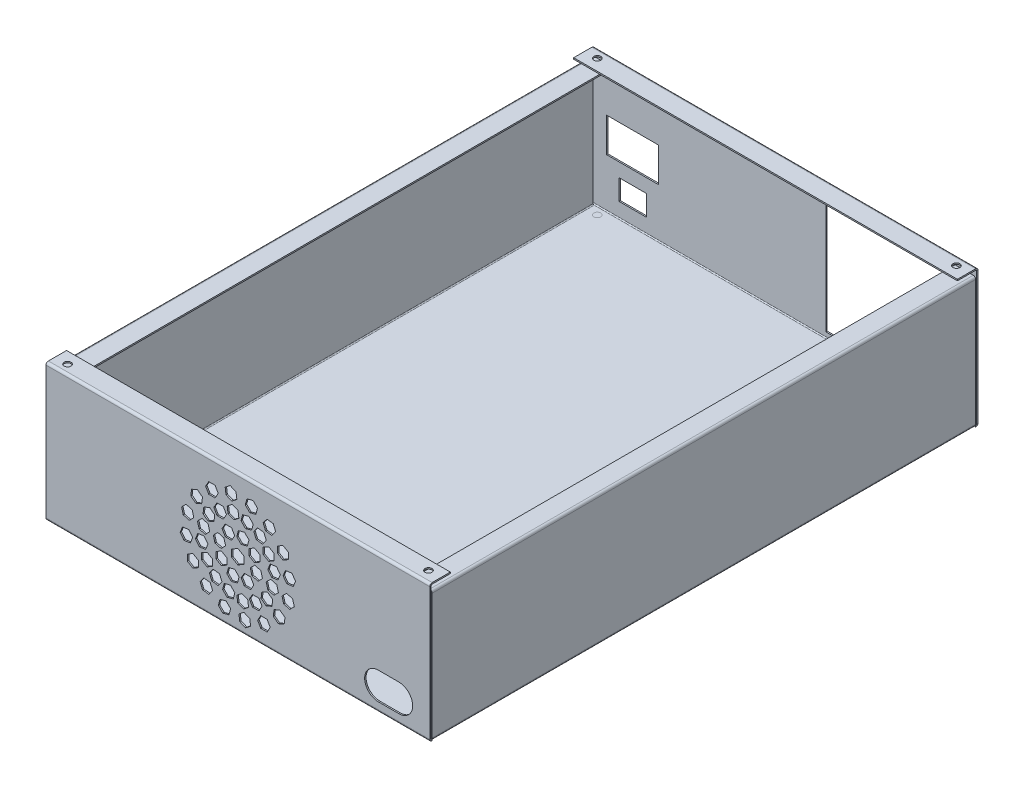
from build123d import *

# Parameters (mm, degrees)
SKETCH2_W                           = 280
SKETCH2_H                           = 400
BASE_FLANGE1_DEPTH                  = 1
FRONT_BACK_PLANES_STRIP_W           = 5.4732
FRONT_BACK_PLANES_STRIP_H           = 1
FRONT_BACK_PLANES_STRIP_CUT_DEPTH   = 280
FRONT_BACK_PLANES_STRIP_2_W         = 5.4732
FRONT_BACK_PLANES_STRIP_2_H         = 1
FRONT_BACK_PLANES_STRIP_CUT_2_DEPTH = 280
FRONT_BACK_PLANES_DEPTH             = 280
FRONT_BACK_PLANES_BEND_DEPTH        = 280
TOP_SLIDERS_STRIP_W                 = 5.4732
TOP_SLIDERS_STRIP_H                 = 1
TOP_SLIDERS_STRIP_CUT_DEPTH         = 280
TOP_SLIDERS_STRIP_2_W               = 5.4732
TOP_SLIDERS_STRIP_2_H               = 1
TOP_SLIDERS_STRIP_CUT_2_DEPTH       = 280
TOP_SLIDERS_DEPTH                   = 280
TOP_SLIDERS_BEND_DEPTH              = 280
LEFT_RIGHT_PLANES_STRIP_W           = 5.4732
LEFT_RIGHT_PLANES_STRIP_H           = 1
LEFT_RIGHT_PLANES_STRIP_CUT_DEPTH   = 396.5268
LEFT_RIGHT_PLANES_STRIP_2_W         = 5.4732
LEFT_RIGHT_PLANES_STRIP_2_H         = 1
LEFT_RIGHT_PLANES_STRIP_CUT_2_DEPTH = 396.5268
LEFT_RIGHT_PLANES_DEPTH             = 396.5268
LEFT_RIGHT_PLANES_BEND_DEPTH        = 396.5268
BOTTOM_SLIDERS_STRIP_W              = 5.4732
BOTTOM_SLIDERS_STRIP_H              = 1
BOTTOM_SLIDERS_STRIP_CUT_DEPTH      = 396.5268
BOTTOM_SLIDERS_STRIP_2_W            = 5.4732
BOTTOM_SLIDERS_STRIP_2_H            = 1
BOTTOM_SLIDERS_STRIP_CUT_2_DEPTH    = 396.5268
BOTTOM_SLIDERS_DEPTH                = 396.5268
BOTTOM_SLIDERS_BEND_DEPTH           = 396.5268
SKETCH51_R                          = 2.5
SCREW_HOLES_BACK_DEPTH              = 99
SKETCH52_R                          = 2.5
SCREW_HOLES_FRONT_DEPTH             = 99
SKETCH57_W                          = 88
SKETCH57_H                          = 88
OUTPUT_DEPTH                        = 1
SKETCH63_W                          = 38
SKETCH63_H                          = 25
SKETCH63_W_2                        = 20
SKETCH63_H_2                        = 15
DISPLAY_AND_BUTTON_DEPTH            = 20
INPUT_SOCKET_DEPTH                  = 20
FAN_OUTLET_DEPTH                    = 10


# Sheet-metal steps are written as plain solids
with BuildPart() as part:
    # Sketch2 → Base-Flange1 (new body)
    with BuildSketch(Plane(origin=(0, 0, 0), x_dir=(1, 0, 0), z_dir=(0, 1, 0))):
        Rectangle(SKETCH2_W, SKETCH2_H)
    extrude(amount=BASE_FLANGE1_DEPTH)

    # Front_back_planes strip (across the edge) → Front_back_planes strip cut (cut)
    with BuildSketch(Plane(origin=(140, 1, -200), x_dir=(0, 0, 1), z_dir=(-1, 0, 0))):
        with Locations((-1, -0.5)):
            Rectangle(FRONT_BACK_PLANES_STRIP_W, FRONT_BACK_PLANES_STRIP_H)
    extrude(amount=FRONT_BACK_PLANES_STRIP_CUT_DEPTH, mode=Mode.SUBTRACT)

    # Front_back_planes strip 2 (across the edge) → Front_back_planes strip cut 2 (cut)
    with BuildSketch(Plane(origin=(-140, 1, 200), x_dir=(0, 0, -1), z_dir=(1, 0, 0))):
        with Locations((-1, -0.5)):
            Rectangle(FRONT_BACK_PLANES_STRIP_2_W, FRONT_BACK_PLANES_STRIP_2_H)
    extrude(amount=FRONT_BACK_PLANES_STRIP_CUT_2_DEPTH, mode=Mode.SUBTRACT)

    # Front_back_planes section (across the edge) → Front_back_planes (add)
    with BuildSketch(Plane(origin=(140, 1, -200), x_dir=(0, 0, 1), z_dir=(-1, 0, 0))):
        with BuildLine():
            Line((0, 0.7366), (0, 99))
            Line((0, 99), (1, 99))
            Line((1, 99), (1, 0.7366))
            ThreePointArc((1, 0.7366), (1.215745145, 0.215745145), (1.7366, 0))
            Line((1.7366, 0), (1.7366, -1))
            ThreePointArc((1.7366, -1), (0.508638364, -0.491361636), (0, 0.7366))
        make_face()
    extrude(amount=FRONT_BACK_PLANES_DEPTH)

    # Front_back_planes section 2 (across the edge) → Front_back_planes bend (add)
    with BuildSketch(Plane(origin=(-140, 1, 200), x_dir=(0, 0, -1), z_dir=(1, 0, 0))):
        with BuildLine():
            Line((0, 0.7366), (0, 99))
            Line((0, 99), (1, 99))
            Line((1, 99), (1, 0.7366))
            ThreePointArc((1, 0.7366), (1.215745145, 0.215745145), (1.7366, 0))
            Line((1.7366, 0), (1.7366, -1))
            ThreePointArc((1.7366, -1), (0.508638364, -0.491361636), (0, 0.7366))
        make_face()
    extrude(amount=FRONT_BACK_PLANES_BEND_DEPTH)

    # Top_sliders strip (across the edge) → Top_sliders strip cut (cut)
    with BuildSketch(Plane(origin=(-140, 100, 199), x_dir=(0, -1, 0), z_dir=(1, 0, 0))):
        with Locations((-1, -0.5)):
            Rectangle(TOP_SLIDERS_STRIP_W, TOP_SLIDERS_STRIP_H)
    extrude(amount=TOP_SLIDERS_STRIP_CUT_DEPTH, mode=Mode.SUBTRACT)

    # Top_sliders strip 2 (across the edge) → Top_sliders strip cut 2 (cut)
    with BuildSketch(Plane(origin=(140, 100, -199), x_dir=(0, -1, 0), z_dir=(-1, 0, 0))):
        with Locations((-1, -0.5)):
            Rectangle(TOP_SLIDERS_STRIP_2_W, TOP_SLIDERS_STRIP_2_H)
    extrude(amount=TOP_SLIDERS_STRIP_CUT_2_DEPTH, mode=Mode.SUBTRACT)

    # Top_sliders section (across the edge) → Top_sliders (add)
    with BuildSketch(Plane(origin=(-140, 100, 199), x_dir=(0, -1, 0), z_dir=(1, 0, 0))):
        with BuildLine():
            Line((0, 0.7366), (0, 14))
            Line((0, 14), (1, 14))
            Line((1, 14), (1, 0.7366))
            ThreePointArc((1, 0.7366), (1.215745145, 0.215745145), (1.7366, 0))
            Line((1.7366, 0), (1.7366, -1))
            ThreePointArc((1.7366, -1), (0.508638364, -0.491361636), (0, 0.7366))
        make_face()
    extrude(amount=TOP_SLIDERS_DEPTH)

    # Top_sliders section 2 (across the edge) → Top_sliders bend (add)
    with BuildSketch(Plane(origin=(140, 100, -199), x_dir=(0, -1, 0), z_dir=(-1, 0, 0))):
        with BuildLine():
            Line((0, 0.7366), (0, 14))
            Line((0, 14), (1, 14))
            Line((1, 14), (1, 0.7366))
            ThreePointArc((1, 0.7366), (1.215745145, 0.215745145), (1.7366, 0))
            Line((1.7366, 0), (1.7366, -1))
            ThreePointArc((1.7366, -1), (0.508638364, -0.491361636), (0, 0.7366))
        make_face()
    extrude(amount=TOP_SLIDERS_BEND_DEPTH)

    # Left_right_planes strip (across the edge) → Left_right_planes strip cut (cut)
    with BuildSketch(Plane(origin=(-140, 1, -198.2634), x_dir=(1, 0, 0), z_dir=(0, 0, 1))):
        with Locations((-1, -0.5)):
            Rectangle(LEFT_RIGHT_PLANES_STRIP_W, LEFT_RIGHT_PLANES_STRIP_H)
    extrude(amount=LEFT_RIGHT_PLANES_STRIP_CUT_DEPTH, mode=Mode.SUBTRACT)

    # Left_right_planes strip 2 (across the edge) → Left_right_planes strip cut 2 (cut)
    with BuildSketch(Plane(origin=(140, 1, 198.2634), x_dir=(-1, 0, 0), z_dir=(0, 0, -1))):
        with Locations((-1, -0.5)):
            Rectangle(LEFT_RIGHT_PLANES_STRIP_2_W, LEFT_RIGHT_PLANES_STRIP_2_H)
    extrude(amount=LEFT_RIGHT_PLANES_STRIP_CUT_2_DEPTH, mode=Mode.SUBTRACT)

    # Left_right_planes section (across the edge) → Left_right_planes (add)
    with BuildSketch(Plane(origin=(-140, 1, -198.2634), x_dir=(1, 0, 0), z_dir=(0, 0, 1))):
        with BuildLine():
            Line((0, 0.7366), (0, 94))
            Line((0, 94), (1, 94))
            Line((1, 94), (1, 0.7366))
            ThreePointArc((1, 0.7366), (1.215745145, 0.215745145), (1.7366, 0))
            Line((1.7366, 0), (1.7366, -1))
            ThreePointArc((1.7366, -1), (0.508638364, -0.491361636), (0, 0.7366))
        make_face()
    extrude(amount=LEFT_RIGHT_PLANES_DEPTH)

    # Left_right_planes section 2 (across the edge) → Left_right_planes bend (add)
    with BuildSketch(Plane(origin=(140, 1, 198.2634), x_dir=(-1, 0, 0), z_dir=(0, 0, -1))):
        with BuildLine():
            Line((0, 0.7366), (0, 94))
            Line((0, 94), (1, 94))
            Line((1, 94), (1, 0.7366))
            ThreePointArc((1, 0.7366), (1.215745145, 0.215745145), (1.7366, 0))
            Line((1.7366, 0), (1.7366, -1))
            ThreePointArc((1.7366, -1), (0.508638364, -0.491361636), (0, 0.7366))
        make_face()
    extrude(amount=LEFT_RIGHT_PLANES_BEND_DEPTH)

    # Bottom_sliders strip (across the edge) → Bottom_sliders strip cut (cut)
    with BuildSketch(Plane(origin=(-139, 95, -198.2634), x_dir=(0, -1, 0), z_dir=(0, 0, 1))):
        with Locations((-1, -0.5)):
            Rectangle(BOTTOM_SLIDERS_STRIP_W, BOTTOM_SLIDERS_STRIP_H)
    extrude(amount=BOTTOM_SLIDERS_STRIP_CUT_DEPTH, mode=Mode.SUBTRACT)

    # Bottom_sliders strip 2 (across the edge) → Bottom_sliders strip cut 2 (cut)
    with BuildSketch(Plane(origin=(139, 95, 198.2634), x_dir=(0, -1, 0), z_dir=(0, 0, -1))):
        with Locations((-1, -0.5)):
            Rectangle(BOTTOM_SLIDERS_STRIP_2_W, BOTTOM_SLIDERS_STRIP_2_H)
    extrude(amount=BOTTOM_SLIDERS_STRIP_CUT_2_DEPTH, mode=Mode.SUBTRACT)

    # Bottom_sliders section (across the edge) → Bottom_sliders (add)
    with BuildSketch(Plane(origin=(-139, 95, -198.2634), x_dir=(0, -1, 0), z_dir=(0, 0, 1))):
        with BuildLine():
            Line((0, 0.7366), (0, 14))
            Line((0, 14), (1, 14))
            Line((1, 14), (1, 0.7366))
            ThreePointArc((1, 0.7366), (1.215745145, 0.215745145), (1.7366, 0))
            Line((1.7366, 0), (1.7366, -1))
            ThreePointArc((1.7366, -1), (0.508638364, -0.491361636), (0, 0.7366))
        make_face()
    extrude(amount=BOTTOM_SLIDERS_DEPTH)

    # Bottom_sliders section 2 (across the edge) → Bottom_sliders bend (add)
    with BuildSketch(Plane(origin=(139, 95, 198.2634), x_dir=(0, -1, 0), z_dir=(0, 0, -1))):
        with BuildLine():
            Line((0, 0.7366), (0, 14))
            Line((0, 14), (1, 14))
            Line((1, 14), (1, 0.7366))
            ThreePointArc((1, 0.7366), (1.215745145, 0.215745145), (1.7366, 0))
            Line((1.7366, 0), (1.7366, -1))
            ThreePointArc((1.7366, -1), (0.508638364, -0.491361636), (0, 0.7366))
        make_face()
    extrude(amount=BOTTOM_SLIDERS_BEND_DEPTH)

    # Sketch51 → Screw_Holes_back (cut)
    with BuildSketch(Plane(origin=(0, 100, 0), x_dir=(1, 0, 0), z_dir=(0, 1, 0))):
        with Locations((131, -191.940102497)):
            Circle(SKETCH51_R)
        with Locations((-131, -193.2634)):
            Circle(SKETCH51_R)
    extrude(amount=-SCREW_HOLES_BACK_DEPTH, mode=Mode.SUBTRACT)

    # Sketch52 → Screw_Holes_front (cut)
    with BuildSketch(Plane(origin=(0, 100, 0), x_dir=(1, 0, 0), z_dir=(0, 1, 0))):
        with Locations((131, 193.2634)):
            Circle(SKETCH52_R)
        with Locations((-131, 193.2634)):
            Circle(SKETCH52_R)
    extrude(amount=-SCREW_HOLES_FRONT_DEPTH, mode=Mode.SUBTRACT)

    # Sketch57 → Output (cut)
    with BuildSketch(Plane(origin=(0, 0, -200), x_dir=(-1, 0, 0), z_dir=(0, 0, -1))):
        with Locations((-74, 48.7366)):
            Rectangle(SKETCH57_W, SKETCH57_H)
    extrude(amount=-OUTPUT_DEPTH, mode=Mode.SUBTRACT)

    # Sketch63 → Display_and_button (cut)
    with BuildSketch(Plane(origin=(0, 0, -200), x_dir=(-1, 0, 0), z_dir=(0, 0, -1))):
        with Locations((111, 49.2366)):
            Rectangle(SKETCH63_W, SKETCH63_H)
        with Locations((111, 19.2366)):
            Rectangle(SKETCH63_W_2, SKETCH63_H_2)
    extrude(amount=-DISPLAY_AND_BUTTON_DEPTH, mode=Mode.SUBTRACT)

    # Sketch66 → Input_Socket (cut)
    with BuildSketch(Plane.XY.offset(200)):
        with BuildLine():
            Line((117.5, 6.7366), (102.5, 6.7366))
            ThreePointArc((102.5, 6.7366), (92.5, 16.7366), (102.5, 26.7366))
            Line((102.5, 26.7366), (117.5, 26.7366))
            ThreePointArc((117.5, 26.7366), (127.5, 16.7366), (117.5, 6.7366))
        make_face()
    extrude(amount=-INPUT_SOCKET_DEPTH, mode=Mode.SUBTRACT)

    # Sketch69 → Fan_outlet (cut)
    with BuildSketch(Plane.XY.offset(200)):
        Polygon((-8.32179677, 69.60492027), (-10.631197846, 73.60492027), (-15.25, 73.60492027), (-17.559401077, 69.60492027), (-15.25, 65.60492027), (-10.631197846, 65.60492027), align=None)
        Polygon((-21.25, 83.997225115), (-23.559401077, 79.997225115), (-21.25, 75.997225115), (-16.631197846, 75.997225115), (-14.32179677, 79.997225115), (-16.631197846, 83.997225115), align=None)
        Polygon((-2.32179677, 59.212615425), (-4.631197846, 63.212615425), (-9.25, 63.212615425), (-11.559401077, 59.212615425), (-9.25, 55.212615425), (-4.631197846, 55.212615425), align=None)
        Polygon((5.38962643, 82.595246841), (8.655612754, 79.329260517), (13.117033041, 80.52469448), (14.312467004, 84.986114766), (11.04648068, 88.25210109), (6.585060393, 87.056667127), align=None)
        Polygon((11.206638462, 73.395004851), (7.940652139, 76.660991175), (3.479231852, 75.465557212), (2.283797889, 71.004136925), (5.549784213, 67.738150601), (10.011204499, 68.933584564), align=None)
        Polygon((8.100809921, 61.803894936), (4.834823597, 65.069881259), (0.373403311, 63.874447296), (-0.822030652, 59.41302701), (2.443955672, 56.147040686), (6.905375958, 57.342474649), align=None)
        Polygon((28.892192832, 68.423692248), (28.892192832, 63.804890094), (32.892192832, 61.495489018), (36.892192832, 63.804890094), (36.892192832, 68.423692248), (32.892192832, 70.733093325), align=None)
        Polygon((26.499887986, 57.804890094), (26.499887986, 62.423692248), (22.499887986, 64.733093325), (18.499887986, 62.423692248), (18.499887986, 57.804890094), (22.499887986, 55.495489018), align=None)
        Polygon((16.107583141, 51.804890094), (16.107583141, 56.423692248), (12.107583141, 58.733093325), (8.107583141, 56.423692248), (8.107583141, 51.804890094), (12.107583141, 49.495489018), align=None)
        Polygon((35.490214557, 41.784065818), (32.224228233, 38.518079494), (33.419662196, 34.056659207), (37.881082483, 32.861225244), (41.147068807, 36.127211568), (39.951634844, 40.588631855), align=None)
        Polygon((26.289972567, 35.967053786), (29.555958891, 39.233040109), (28.360524928, 43.694460396), (23.899104642, 44.889894359), (20.633118318, 41.623908035), (21.828552281, 37.162487748), align=None)
        Polygon((14.698862652, 39.072882327), (17.964848976, 42.338868651), (16.769415013, 46.800288937), (12.307994726, 47.9957229), (9.042008402, 44.729736576), (10.237442365, 40.26831629), align=None)
        Polygon((21.318659964, 18.281499416), (16.699857811, 18.281499416), (14.390456734, 14.281499416), (16.699857811, 10.281499416), (21.318659964, 10.281499416), (23.628061041, 14.281499416), align=None)
        Polygon((10.699857811, 20.673804261), (15.318659964, 20.673804261), (17.628061041, 24.673804261), (15.318659964, 28.673804261), (10.699857811, 28.673804261), (8.390456734, 24.673804261), align=None)
        Polygon((4.699857811, 31.066109107), (9.318659964, 31.066109107), (11.628061041, 35.066109107), (9.318659964, 39.066109107), (4.699857811, 39.066109107), (2.390456734, 35.066109107), align=None)
        Polygon((-5.320966466, 11.683477691), (-8.58695279, 14.949464014), (-13.048373076, 13.754030052), (-14.243807039, 9.292609765), (-10.977820715, 6.026623441), (-6.516400429, 7.222057404), align=None)
        Polygon((-11.137978498, 20.88371968), (-7.871992174, 17.617733357), (-3.410571888, 18.81316732), (-2.215137925, 23.274587606), (-5.481124248, 26.54057393), (-9.942544535, 25.345139967), align=None)
        Polygon((-8.032149957, 32.474829596), (-4.766163633, 29.208843272), (-0.304743346, 30.404277235), (0.890690616, 34.865697522), (-2.375295707, 38.131683845), (-6.836715994, 36.936249883), align=None)
        Polygon((-28.823532867, 25.855032284), (-28.823532867, 30.473834437), (-32.823532867, 32.783235514), (-36.823532867, 30.473834437), (-36.823532867, 25.855032284), (-32.823532867, 23.545631207), align=None)
        Polygon((-26.431228022, 36.473834437), (-26.431228022, 31.855032284), (-22.431228022, 29.545631207), (-18.431228022, 31.855032284), (-18.431228022, 36.473834437), (-22.431228022, 38.783235514), align=None)
        Polygon((-16.038923177, 42.473834437), (-16.038923177, 37.855032284), (-12.038923177, 35.545631207), (-8.038923177, 37.855032284), (-8.038923177, 42.473834437), (-12.038923177, 44.783235514), align=None)
        Polygon((-35.421554593, 52.494658714), (-32.155568269, 55.760645038), (-33.351002232, 60.222065324), (-37.812422519, 61.417499287), (-41.078408842, 58.151512963), (-39.882974879, 53.690092677), align=None)
        Polygon((-26.221312603, 58.311670746), (-29.487298927, 55.045684422), (-28.291864964, 50.584264136), (-23.830444677, 49.388830173), (-20.564458354, 52.654816496), (-21.759892316, 57.116236783), align=None)
        Polygon((-14.630202688, 55.205842205), (-17.896189011, 51.939855881), (-16.700755048, 47.478435594), (-12.239334762, 46.283001631), (-8.973348438, 49.548987955), (-10.168782401, 54.010408242), align=None)
        Polygon((0, 52.387297877), (-4.5, 49.789221666), (-4.5, 44.593069243), (0, 41.994993032), (4.5, 44.593069243), (4.5, 49.789221666), align=None)
        Polygon((-33.767694793, 72.997981532), (-34.361675819, 68.417531786), (-30.691880491, 65.612904256), (-26.428104138, 67.388726471), (-25.834123112, 71.969176217), (-29.50391844, 74.773803748), align=None)
        Polygon((-42.125554765, 41.561968273), (-39.3066957, 37.903093185), (-34.728587393, 38.514859202), (-32.96933815, 42.785500305), (-35.788197215, 46.444375393), (-40.366305522, 45.832609376), align=None)
        Polygon((-25.806836078, 13.423450661), (-21.226386332, 12.829469635), (-18.421758801, 16.499264963), (-20.197581017, 20.763041317), (-24.778030762, 21.357022343), (-27.582658293, 17.687227015), align=None)
        Polygon((5.629177182, 5.06559069), (9.288052269, 7.884449755), (8.676286253, 12.462558062), (4.405645149, 14.221807304), (0.746770062, 11.40294824), (1.358536078, 6.824839932), align=None)
        Polygon((33.767694793, 21.384309377), (34.361675819, 25.964759123), (30.691880491, 28.769386653), (26.428104138, 26.993564438), (25.834123112, 22.413114692), (29.50391844, 19.608487162), align=None)
        Polygon((42.125554765, 52.820322636), (39.3066957, 56.479197724), (34.728587393, 55.867431708), (32.96933815, 51.596790604), (35.788197215, 47.937915516), (40.366305522, 48.549681533), align=None)
        Polygon((25.806836078, 80.958840248), (21.226386332, 81.552821274), (18.421758801, 77.883025946), (20.197581017, 73.619249592), (24.778030762, 73.025268567), (27.582658293, 76.695063894), align=None)
        Polygon((-5.629177182, 89.31670022), (-9.288052269, 86.497841155), (-8.676286253, 81.919732847), (-4.405645149, 80.160483605), (-0.746770062, 82.97934267), (-1.358536078, 87.557450977), align=None)
        Polygon((-24.839036147, 66.174287126), (-25.433017173, 61.59383738), (-21.763221845, 58.78920985), (-17.499445492, 60.565032065), (-16.905464466, 65.145481811), (-20.575259794, 67.950109341), align=None)
        Polygon((-18.983141672, 22.352109307), (-14.402691926, 21.758128281), (-11.598064395, 25.427923609), (-13.37388661, 29.691699963), (-17.954336356, 30.285680988), (-20.758963887, 26.615885661), align=None)
        Polygon((4.140742694, 16.204186352), (7.799617781, 19.023045417), (7.187851765, 23.601153725), (2.917210661, 25.360402967), (-0.741664426, 22.541543902), (-0.12989841, 17.963435595), align=None)
        Polygon((24.839036147, 28.208003783), (25.433017173, 32.788453529), (21.763221845, 35.593081059), (17.499445492, 33.817258844), (16.905464466, 29.236809098), (20.575259794, 26.432181568), align=None)
        Polygon((30.986959102, 51.331888148), (28.168100037, 54.990763236), (23.58999173, 54.378997219), (21.830742487, 50.108356116), (24.649601552, 46.449481028), (29.22770986, 47.061247045), align=None)
        Polygon((18.983141672, 72.030181602), (14.402691926, 72.624162628), (11.598064395, 68.9543673), (13.37388661, 64.690590946), (17.954336356, 64.096609921), (20.758963887, 67.766405248), align=None)
        Polygon((-4.140742694, 78.178104557), (-7.799617781, 75.359245492), (-7.187851765, 70.781137184), (-2.917210661, 69.021887942), (0.741664426, 71.840747007), (0.12989841, 76.418855314), align=None)
        Polygon((-21.813121535, 44.276289456), (-24.6319806, 47.935164543), (-29.210088908, 47.323398527), (-30.96933815, 43.052757423), (-28.150479085, 39.393882336), (-23.572370778, 40.005648352), align=None)
    extrude(amount=-FAN_OUTLET_DEPTH, mode=Mode.SUBTRACT)


solid = part.part
